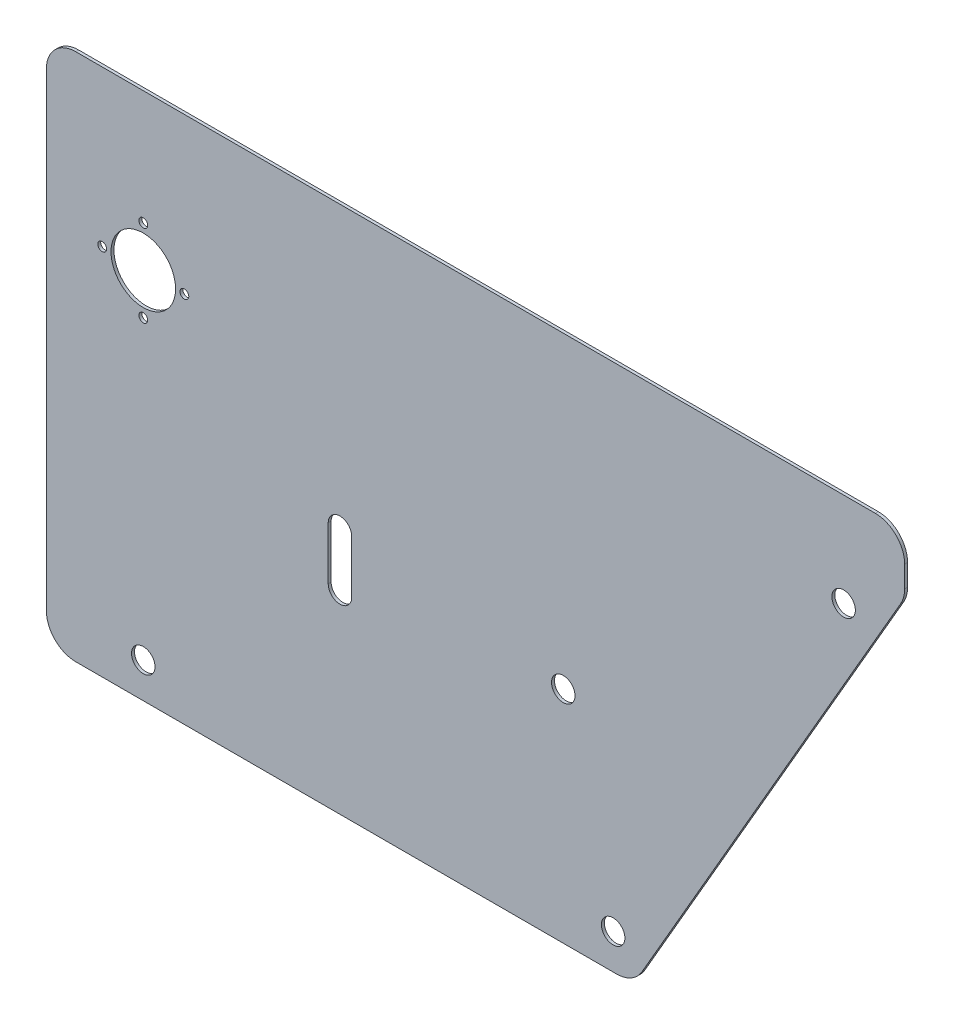
from build123d import *

# Parameters (mm, degrees)
BOSS_EXTRUDE1_DEPTH = 1
FILLET1_R           = 10
SKETCH2_R           = 4
SKETCH2_R_2         = 11
SKETCH2_R_3         = 1.5
CUT_EXTRUDE1_DEPTH  = 3


with BuildPart() as part:
    # Sketch1 → Boss-Extrude1 (new body)
    with BuildSketch(Plane.XY):
        Polygon((-100, 100), (-100, -80), (100, -80), (192.37604307, 80), (192.37604307, 100), align=None)
    extrude(amount=BOSS_EXTRUDE1_DEPTH)

    # Fillet1
    fillet1_edges = [part.edges().sort_by_distance(p)[0] for p in [
        (100, -80, 0.5),
        (-100, -80, 0.5),
        (192.37604307, 100, 0.5),
        (192.37604307, 80, 0.5),
        (-100, 100, 0.5),
    ]]
    fillet(fillet1_edges, radius=FILLET1_R)

    # Sketch2 → Cut-Extrude1 (cut)
    with BuildSketch(Plane.XY.offset(1)):
        with Locations((93.07179677, -68)):
            Circle(SKETCH2_R)
        with Locations((171.59143338, 68)):
            Circle(SKETCH2_R)
        with Locations((-67, 47)):
            Circle(SKETCH2_R_2)
        with Locations((-67, -68)):
            Circle(SKETCH2_R)
        with Locations((-53, 47)):
            Circle(SKETCH2_R_3)
        with Locations((-67, 61)):
            Circle(SKETCH2_R_3)
        with Locations((-81, 47)):
            Circle(SKETCH2_R_3)
        with Locations((-67, 33)):
            Circle(SKETCH2_R_3)
        with Locations((76.08145631, -5)):
            Circle(SKETCH2_R)
        with BuildLine():
            Line((-4, -14), (-4, 4))
            ThreePointArc((-4, 4), (0, 8), (4, 4))
            Line((4, 4), (4, -14))
            ThreePointArc((4, -14), (0, -18), (-4, -14))
        make_face()
    extrude(amount=-CUT_EXTRUDE1_DEPTH, mode=Mode.SUBTRACT)


solid = part.part
